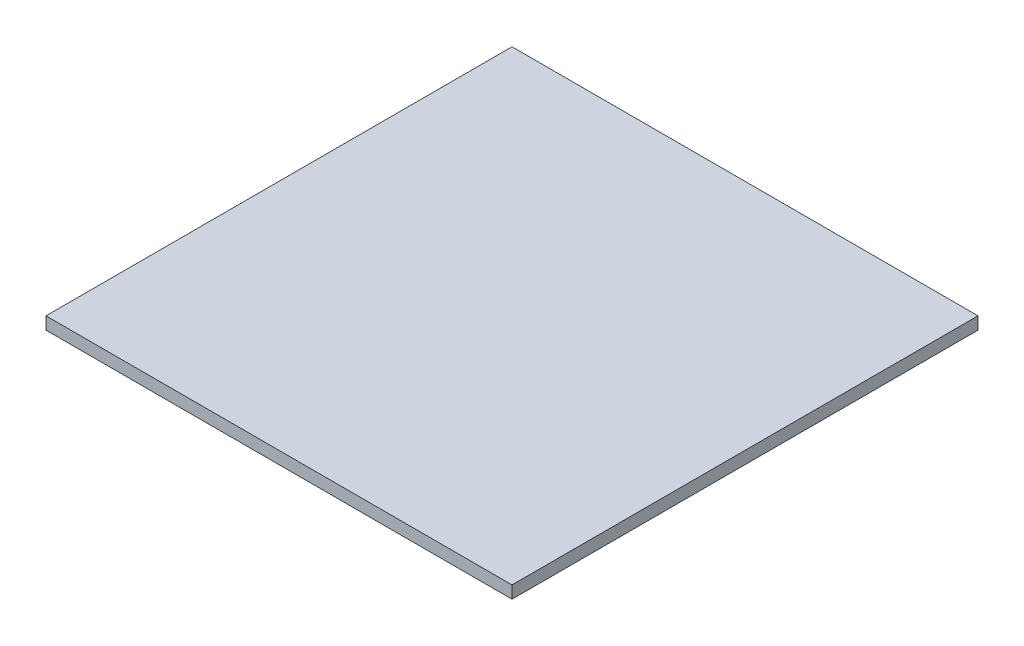
from build123d import *

# Parameters (mm, degrees)
ESQUISSE1_W        = 300
ESQUISSE1_H        = 300
BOSS_EXTRU_1_DEPTH = 8


with BuildPart() as part:
    # Esquisse1 → Boss.-Extru.1 (new body)
    with BuildSketch(Plane(origin=(0, 0, 0), x_dir=(1, 0, 0), z_dir=(0, 1, 0))):
        Rectangle(ESQUISSE1_W, ESQUISSE1_H)
    extrude(amount=BOSS_EXTRU_1_DEPTH)


solid = part.part
